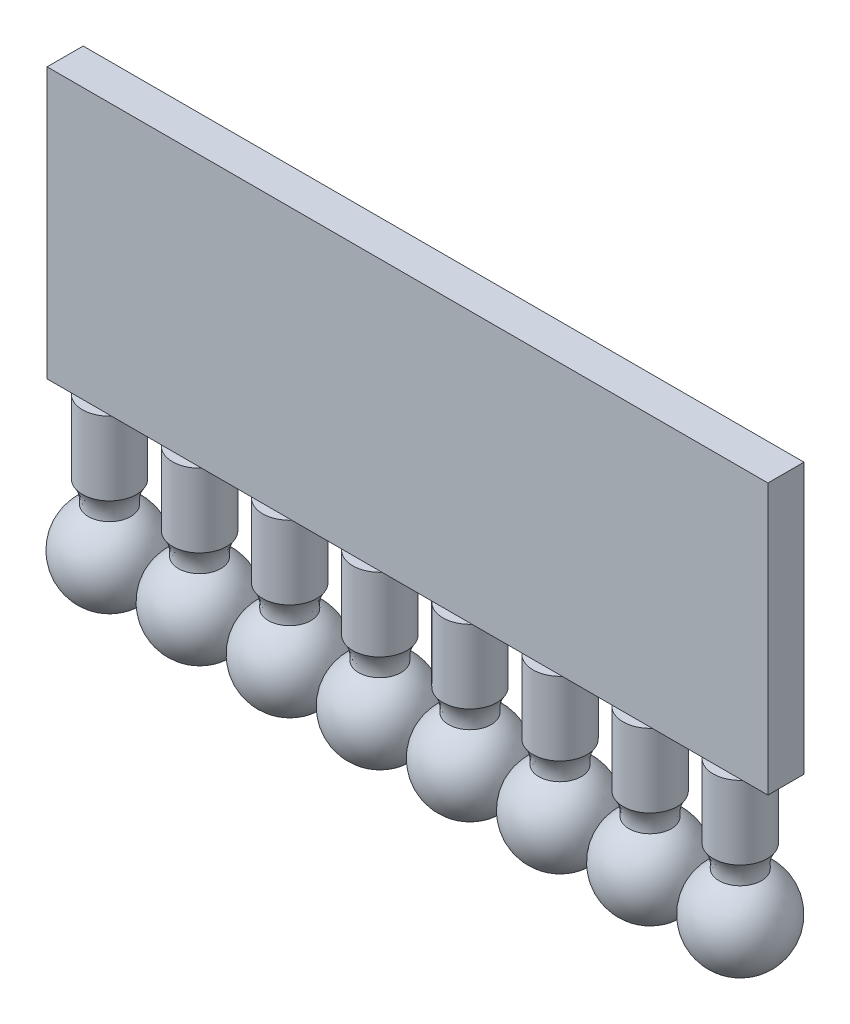
from build123d import *

# Parameters (mm, degrees)
SKETCH_1_W      = 40
SKETCH_1_H      = 15
EXTRUDE_1_DEPTH = 2


# Read off the part's stored shape, not the designer's step: 实体-移动/复制3
with BuildPart() as part:
    # 草图1 → 凸台-拉伸1 (new body)
    with BuildSketch(Plane.XY):
        with Locations((20, 7.5)):
            Rectangle(SKETCH_1_W, SKETCH_1_H)
    extrude(amount=EXTRUDE_1_DEPTH)


with BuildPart() as body_2:
    # 草图4 → 旋转2 (revolve)
    with BuildSketch(Plane.XY.offset(1), mode=Mode.PRIVATE) as revolve_2_sk:
        with BuildLine():
            Line((1.713541635, 0), (3.213541635, 0))
            Line((3.213541635, 0), (3.213541635, -4.070890859))
            add(Edge.make_bspline(
                [(3.213541635, -4.070890859), (2.821125169, -4.639795434), (2.891969931, -5.295162875)],
                knots=[0, 0, 0, 1, 1, 1], degree=2))
            ThreePointArc((2.891969931, -5.295162875), (4.138628521, -8.107415503), (1.713541635, -10))
            Line((1.713541635, -10), (1.713541635, 0))
        make_face()
    revolve(revolve_2_sk.sketch.rotate(Axis((1.713541635, 0, 1), (0, -1, 0)), 180), axis=Axis((1.713541635, 0, 1), (0, -1, 0)))


with BuildPart() as body_3:
    # Move Body 2: copy of body 2
    add(body_2.part.moved(Location((5, 0, 0))))


with BuildPart() as body_4:
    # Move Body 3 outline → Move Body 3 (revolve)
    with BuildSketch(Plane(origin=(36.713541635, 0, 1), x_dir=(1, 0, 0), z_dir=(0, 0, 1))):
        with BuildLine():
            ThreePointArc((0, -10), (2.425086887, -8.107415503), (1.178428296, -5.295162874))
            add(Edge.make_bspline(
                [(1.178428296, -5.295162874), (1.107583535, -4.639795434), (1.5, -4.070890859)],
                knots=[0, 0, 0, 1, 1, 1], degree=2))
            Line((1.5, -4.070890859), (1.5, 0))
            Line((1.5, 0), (0, 0))
            Line((0, 0), (0, -10))
        make_face()
    revolve(axis=Axis((36.713541635, 0, 1), (0, 1, 0)))


with BuildPart() as body_5:
    # Move Body 3 2 outline → Move Body 3 2 (revolve)
    with BuildSketch(Plane(origin=(31.713541635, 0, 1), x_dir=(1, 0, 0), z_dir=(0, 0, 1))):
        with BuildLine():
            ThreePointArc((0, -10), (2.425086887, -8.107415503), (1.178428296, -5.295162874))
            add(Edge.make_bspline(
                [(1.178428296, -5.295162874), (1.107583535, -4.639795434), (1.5, -4.070890859)],
                knots=[0, 0, 0, 1, 1, 1], degree=2))
            Line((1.5, -4.070890859), (1.5, 0))
            Line((1.5, 0), (0, 0))
            Line((0, 0), (0, -10))
        make_face()
    revolve(axis=Axis((31.713541635, 0, 1), (0, 1, 0)))


with BuildPart() as body_6:
    # Move Body 3 3 outline → Move Body 3 3 (revolve)
    with BuildSketch(Plane(origin=(26.713541635, 0, 1), x_dir=(1, 0, 0), z_dir=(0, 0, 1))):
        with BuildLine():
            ThreePointArc((0, -10), (2.425086887, -8.107415503), (1.178428296, -5.295162874))
            add(Edge.make_bspline(
                [(1.178428296, -5.295162874), (1.107583535, -4.639795434), (1.5, -4.070890859)],
                knots=[0, 0, 0, 1, 1, 1], degree=2))
            Line((1.5, -4.070890859), (1.5, 0))
            Line((1.5, 0), (0, 0))
            Line((0, 0), (0, -10))
        make_face()
    revolve(axis=Axis((26.713541635, 0, 1), (0, 1, 0)))


with BuildPart() as body_7:
    # Move Body 3 4 outline → Move Body 3 4 (revolve)
    with BuildSketch(Plane(origin=(21.713541635, 0, 1), x_dir=(1, 0, 0), z_dir=(0, 0, 1))):
        with BuildLine():
            ThreePointArc((0, -10), (2.425086887, -8.107415503), (1.178428296, -5.295162874))
            add(Edge.make_bspline(
                [(1.178428296, -5.295162874), (1.107583535, -4.639795434), (1.5, -4.070890859)],
                knots=[0, 0, 0, 1, 1, 1], degree=2))
            Line((1.5, -4.070890859), (1.5, 0))
            Line((1.5, 0), (0, 0))
            Line((0, 0), (0, -10))
        make_face()
    revolve(axis=Axis((21.713541635, 0, 1), (0, 1, 0)))


with BuildPart() as body_8:
    # Move Body 3 5 outline → Move Body 3 5 (revolve)
    with BuildSketch(Plane(origin=(16.713541635, 0, 1), x_dir=(1, 0, 0), z_dir=(0, 0, 1))):
        with BuildLine():
            ThreePointArc((0, -10), (2.425086887, -8.107415503), (1.178428296, -5.295162874))
            add(Edge.make_bspline(
                [(1.178428296, -5.295162874), (1.107583535, -4.639795434), (1.5, -4.070890859)],
                knots=[0, 0, 0, 1, 1, 1], degree=2))
            Line((1.5, -4.070890859), (1.5, 0))
            Line((1.5, 0), (0, 0))
            Line((0, 0), (0, -10))
        make_face()
    revolve(axis=Axis((16.713541635, 0, 1), (0, 1, 0)))


with BuildPart() as body_9:
    # Move Body 3 6 outline → Move Body 3 6 (revolve)
    with BuildSketch(Plane(origin=(11.713541635, 0, 1), x_dir=(1, 0, 0), z_dir=(0, 0, 1))):
        with BuildLine():
            ThreePointArc((0, -10), (2.425086887, -8.107415503), (1.178428296, -5.295162874))
            add(Edge.make_bspline(
                [(1.178428296, -5.295162874), (1.107583535, -4.639795434), (1.5, -4.070890859)],
                knots=[0, 0, 0, 1, 1, 1], degree=2))
            Line((1.5, -4.070890859), (1.5, 0))
            Line((1.5, 0), (0, 0))
            Line((0, 0), (0, -10))
        make_face()
    revolve(axis=Axis((11.713541635, 0, 1), (0, 1, 0)))


with BuildPart() as body_2_1:
    # Move Body 4: moved
    add(body_2.part.moved(Location((0.75, 0, 0))))


with BuildPart() as body_3_1:
    # Move Body 4: moved
    add(body_3.part.moved(Location((0.75, 0, 0))))


with BuildPart() as body_9_1:
    # Move Body 4: moved
    add(body_9.part.moved(Location((0.75, 0, 0))))


with BuildPart() as body_8_1:
    # Move Body 4: moved
    add(body_8.part.moved(Location((0.75, 0, 0))))


with BuildPart() as body_7_1:
    # Move Body 4: moved
    add(body_7.part.moved(Location((0.75, 0, 0))))


with BuildPart() as body_6_1:
    # Move Body 4: moved
    add(body_6.part.moved(Location((0.75, 0, 0))))


with BuildPart() as body_5_1:
    # Move Body 4: moved
    add(body_5.part.moved(Location((0.75, 0, 0))))


with BuildPart() as body_4_1:
    # Move Body 4: moved
    add(body_4.part.moved(Location((0.75, 0, 0))))


solid = Compound([part.part, body_2_1.part, body_3_1.part, body_9_1.part, body_8_1.part, body_7_1.part, body_6_1.part, body_5_1.part, body_4_1.part])
